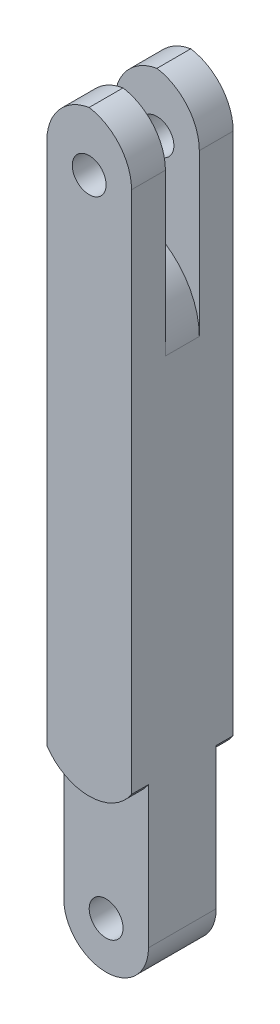
from build123d import *

# Parameters (mm, degrees)
CROQUIS1_R              = 1
SALIENTE_EXTRUIR1_DEPTH = 6
CROQUIS2_W              = 5
CROQUIS2_H              = 2
CORTAR_EXTRUIR1_DEPTH   = 8
REDONDEO1_R             = 4.5
REDONDEO2_R             = 3
CORTAR_EXTRUIR3_START   = -1
CORTAR_EXTRUIR3_DEPTH   = 1


with BuildPart() as part:
    # Croquis1 → Saliente-Extruir1 (new body)
    # profile 1 of 2: a face of its own
    with BuildSketch(Plane.XY):
        with BuildLine():
            Line((-0.968245837, -0.25), (-2.5, -0.25))
            ThreePointArc((-2.5, -0.25), (0, -2.75), (2.5, -0.25))
            Line((2.5, -0.25), (0.968245837, -0.25))
            ThreePointArc((0.968245837, -0.25), (0, -1), (-0.968245837, -0.25))
        make_face()
    # profile 2 of 2: a face of its own
    with BuildSketch(Plane.XY):
        with BuildLine():
            Line((-2.5, -0.25), (-0.968245837, -0.25))
            ThreePointArc((-0.968245837, -0.25), (0, 1), (0.968245837, -0.25))
            Line((0.968245837, -0.25), (2.5, -0.25))
            Line((2.5, -0.25), (2.5, 42))
            Line((2.5, 42), (-2.5, 42))
            Line((-2.5, 42), (-2.5, -0.25))
        make_face()
        with Locations((0, 38.5)):
            Circle(CROQUIS1_R, mode=Mode.SUBTRACT)
    extrude(amount=SALIENTE_EXTRUIR1_DEPTH)

    # Croquis2 → Cortar-Extruir1 (cut)
    with BuildSketch(Plane(origin=(0, 42, 0), x_dir=(1, 0, 0), z_dir=(0, 1, 0))):
        with Locations((0, -3)):
            Rectangle(CROQUIS2_W, CROQUIS2_H)
    extrude(amount=-CORTAR_EXTRUIR1_DEPTH, mode=Mode.SUBTRACT)

    # Redondeo1
    # the kernel refuses this fillet: 4.5 mm, written as the material it takes off along each edge
    with BuildSketch(Plane(origin=(-2.5, 34, 4), x_dir=(0, -1, 0), z_dir=(0, 0, -1)), Plane(origin=(2.5, 34, 2), x_dir=(0, -1, 0), z_dir=(0, 0, 1))) as redondeo1_piece_1:
        with BuildLine():
            CenterArc((REDONDEO1_R, -REDONDEO1_R), REDONDEO1_R, 90, 90)
            Line((0, -REDONDEO1_R), (0, 0))
            Line((0, 0), (REDONDEO1_R, 0))
        make_face()
    extrude(amount=2, mode=Mode.SUBTRACT)

    # Redondeo2
    # the kernel refuses this fillet: 3 mm, written as the material it takes off along each edge
    with BuildSketch(Plane(origin=(-2.5, 42, -3.5), x_dir=(0, -1, 0), z_dir=(0, 0, 1)), Plane(origin=(2.5, 42, -7.5), x_dir=(-1, 0, 0), z_dir=(0, 0, 1)), Plane(origin=(2.5, 42, -3.5), x_dir=(-1, 0, 0), z_dir=(0, 0, 1))) as redondeo2_piece_1:
        with BuildLine():
            CenterArc((REDONDEO2_R, REDONDEO2_R), REDONDEO2_R, 180, 90)
            Line((0, REDONDEO2_R), (0, 0))
            Line((0, 0), (REDONDEO2_R, 0))
        make_face()
    extrude(amount=17, mode=Mode.SUBTRACT)
    with BuildSketch(Plane(origin=(-2.5, 42, -7.5), x_dir=(1, 0, 0), z_dir=(0, 0, 1))) as redondeo2_piece_2:
        with BuildLine():
            CenterArc((REDONDEO2_R, -REDONDEO2_R), REDONDEO2_R, 90, 90)
            Line((0, -REDONDEO2_R), (0, 0))
            Line((0, 0), (REDONDEO2_R, 0))
        make_face()
    extrude(amount=17, mode=Mode.SUBTRACT)

    # Croquis4 → Cortar-Extruir3 (cut)
    with BuildSketch(Plane.XY.offset(6).offset(CORTAR_EXTRUIR3_START)):
        with BuildLine():
            Line((-2.5, 8.091687605), (-2.5, -0.25))
            ThreePointArc((-2.5, -0.25), (0, -2.75), (2.5, -0.25))
            Line((2.5, -0.25), (2.5, 8.091687605))
            ThreePointArc((2.5, 8.091687605), (0, 6.75), (-2.5, 8.091687605))
        make_face()
    cortar_extruir3 = extrude(amount=CORTAR_EXTRUIR3_DEPTH, mode=Mode.SUBTRACT)

    # Simetría1: Cortar-Extruir3 across plane
    add(cortar_extruir3.mirror(Plane.XY.offset(3)), mode=Mode.SUBTRACT)


solid = part.part
